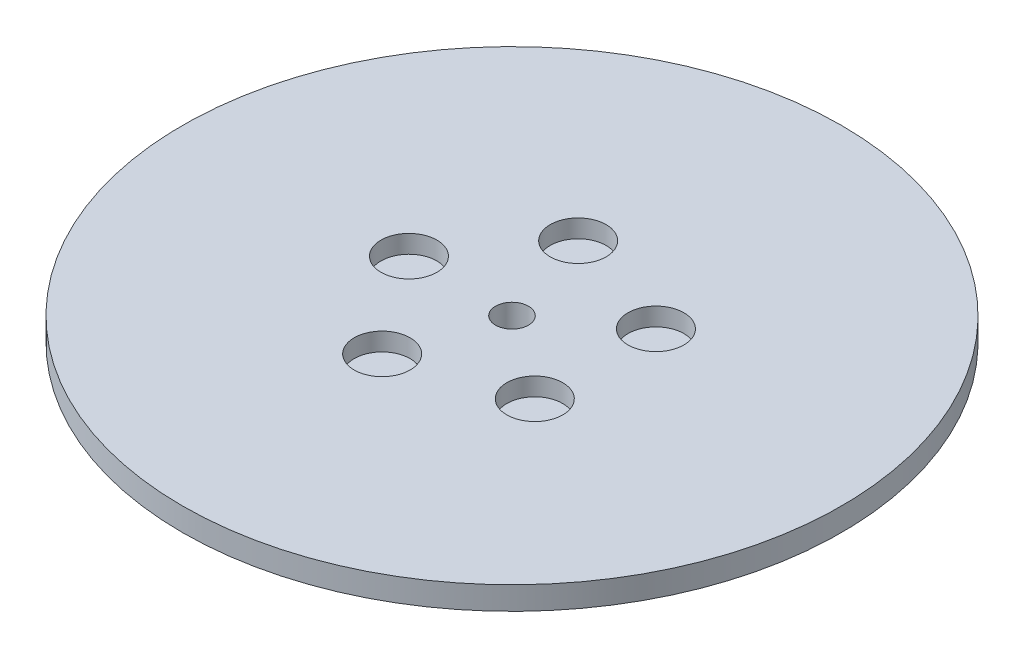
from build123d import *

# Parameters (mm, degrees)
SKETCH1_R           = 100
BOSS_EXTRUDE1_DEPTH = 7
SKETCH2_R           = 5
CUT_EXTRUDE1_DEPTH  = 142.594491418
SKETCH3_R           = 8.479886046
CUT_EXTRUDE2_DEPTH  = 5.482683901
CIRPATTERN1_COUNT   = 5


with BuildPart() as part:
    # Sketch1 → Boss-Extrude1 (new body)
    with BuildSketch(Plane(origin=(0, 0, 0), x_dir=(1, 0, 0), z_dir=(0, 1, 0))):
        Circle(SKETCH1_R)
    extrude(amount=BOSS_EXTRUDE1_DEPTH)

    # Sketch2 → Cut-Extrude1 (cut, through all)
    with BuildSketch(Plane(origin=(0, 0, 0), x_dir=(1, 0, 0), z_dir=(0, 1, 0))):
        Circle(SKETCH2_R)
    extrude(amount=CUT_EXTRUDE1_DEPTH, mode=Mode.SUBTRACT)

    # Sketch3 → Cut-Extrude2 (cut)
    with BuildSketch(Plane(origin=(0, 7, 0), x_dir=(1, 0, 0), z_dir=(0, 1, 0))):
        with Locations((-31.267640686, 0)):
            Circle(SKETCH3_R)
    cut_extrude2 = extrude(amount=-CUT_EXTRUDE2_DEPTH, mode=Mode.SUBTRACT)

    # CirPattern1: Cut-Extrude2 ×5 about axis
    cirpattern1_axis = Axis((0, 0, 0), (0, 1, 0))
    for i in range(1, CIRPATTERN1_COUNT):
        add(cut_extrude2.rotate(cirpattern1_axis, i * 360 / CIRPATTERN1_COUNT), mode=Mode.SUBTRACT)


solid = part.part
